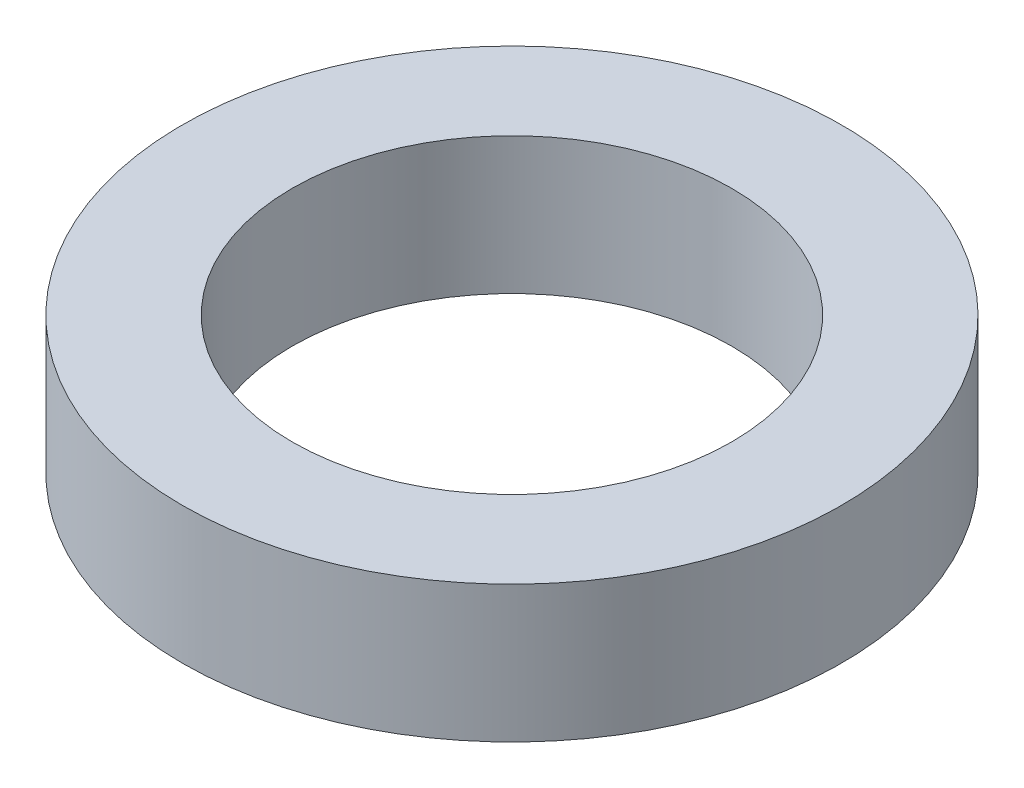
from build123d import *

# Parameters (mm, degrees)
SKETCH1_R           = 67.5
BOSS_EXTRUDE1_DEPTH = 28
SKETCH2_R           = 45
CUT_EXTRUDE1_DEPTH  = 100.481153994


with BuildPart() as part:
    # Sketch1 → Boss-Extrude1 (new body)
    with BuildSketch(Plane(origin=(0, 0, 0), x_dir=(1, 0, 0), z_dir=(0, 1, 0))):
        Circle(SKETCH1_R)
    extrude(amount=BOSS_EXTRUDE1_DEPTH)

    # Sketch2 → Cut-Extrude1 (cut, through all)
    with BuildSketch(Plane(origin=(0, 0, 0), x_dir=(1, 0, 0), z_dir=(0, 1, 0))):
        Circle(SKETCH2_R)
    extrude(amount=CUT_EXTRUDE1_DEPTH, mode=Mode.SUBTRACT)


solid = part.part
